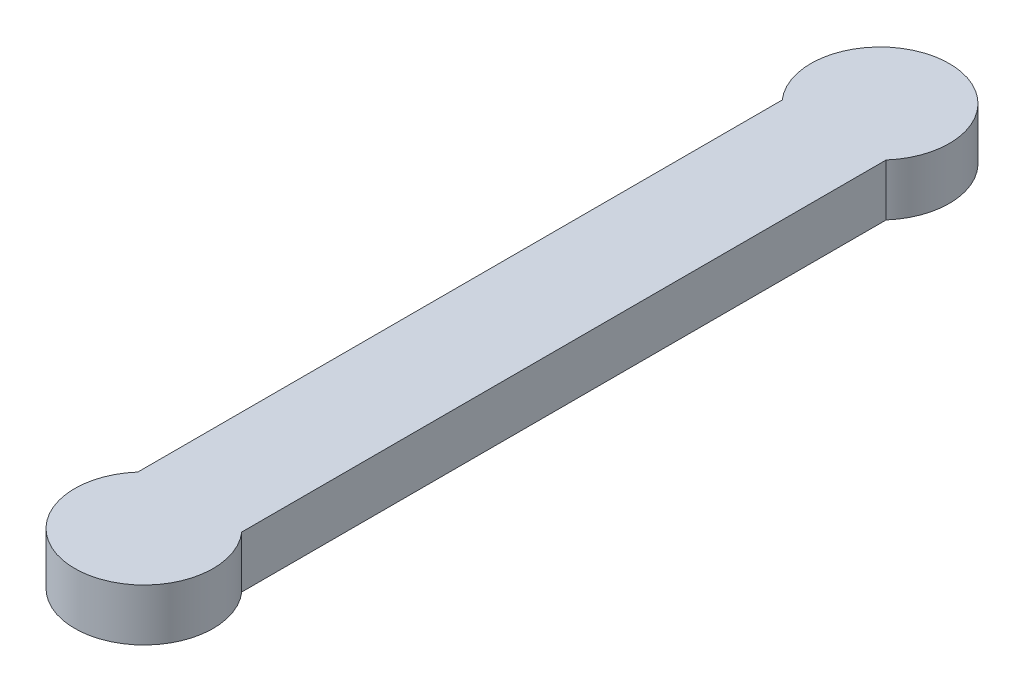
from build123d import *

# Parameters (mm, degrees)
BOSS_EXTRUDE1_DEPTH = 3


with BuildPart() as part:
    # Sketch1 → Boss-Extrude1 (new body)
    with BuildSketch(Plane(origin=(0, 0, 0), x_dir=(1, 0, 0), z_dir=(0, 1, 0))):
        with BuildLine():
            Line((-3, 39.854248689), (-3, 2.645751311))
            ThreePointArc((-3, 2.645751311), (0, -4), (3, 2.645751311))
            Line((3, 2.645751311), (3, 39.854248689))
            ThreePointArc((3, 39.854248689), (0, 46.5), (-3, 39.854248689))
        make_face()
    extrude(amount=BOSS_EXTRUDE1_DEPTH)


solid = part.part
